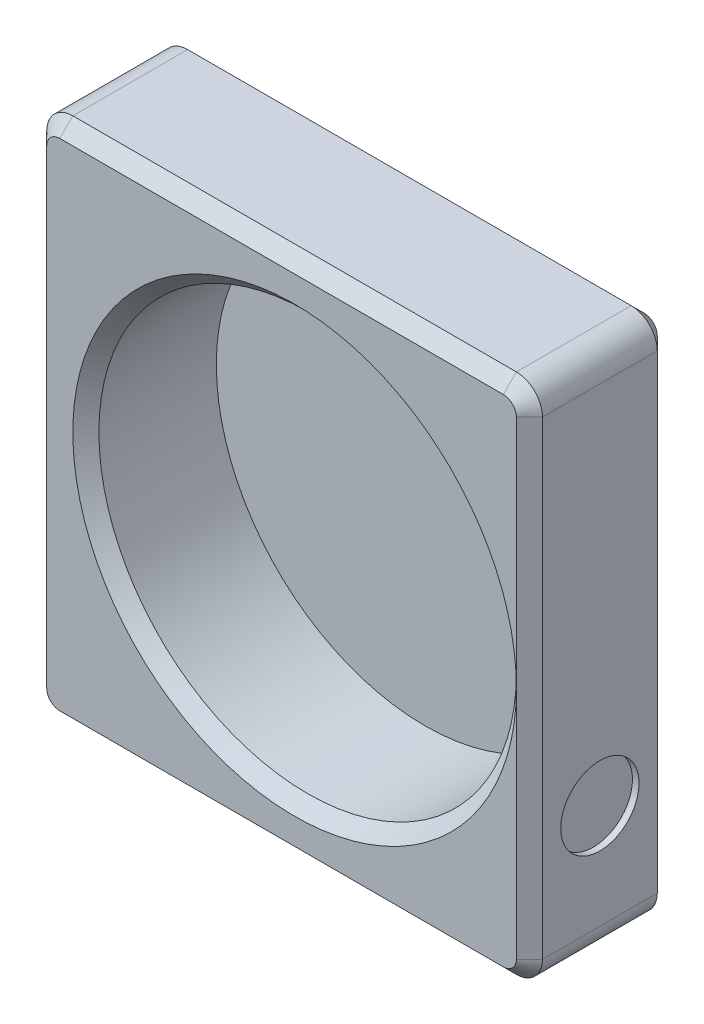
from build123d import *

# Parameters (mm, degrees)
SKETCH1_W           = 20
SKETCH1_H           = 20
BOSS_EXTRUDE1_DEPTH = 5.4
SKETCH2_R           = 8
CUT_EXTRUDE1_DEPTH  = 5
SKETCH4_W           = 1
SKETCH4_H           = 20
CUT_EXTRUDE3_DEPTH  = 10
SKETCH3_R           = 1.5
CUT_EXTRUDE2_DEPTH  = 0.25
SKETCH5_W           = 5.4
SKETCH5_H           = 1
CUT_EXTRUDE4_DEPTH  = 0.25
FILLET1_R           = 1
CHAMFER1_SIZE       = 0.5


with BuildPart() as part:
    # Sketch1 → Boss-Extrude1 (new body)
    with BuildSketch(Plane.XY):
        Rectangle(SKETCH1_W, SKETCH1_H)
    extrude(amount=BOSS_EXTRUDE1_DEPTH)

    # Sketch2 → Cut-Extrude1 (cut)
    with BuildSketch(Plane.XY.offset(5.4)):
        Circle(SKETCH2_R)
    extrude(amount=-CUT_EXTRUDE1_DEPTH, mode=Mode.SUBTRACT)

    # Sketch4 → Cut-Extrude3 (cut)
    with BuildSketch(Plane.XY.offset(5.4)):
        with Locations((9.5, 0)):
            Rectangle(SKETCH4_W, SKETCH4_H)
    extrude(amount=-CUT_EXTRUDE3_DEPTH, mode=Mode.SUBTRACT)

    # Sketch3 → Cut-Extrude2 (cut)
    with BuildSketch(Plane(origin=(9, 0, 0), x_dir=(0, 0, -1), z_dir=(1, 0, 0))):
        with Locations(Location((-2.7, -5, 0), (0, 0, 90))):
            Circle(SKETCH3_R)
    extrude(amount=-CUT_EXTRUDE2_DEPTH, mode=Mode.SUBTRACT)

    # Sketch5 → Cut-Extrude4 (cut)
    with BuildSketch(Plane.ZY.offset(10)):
        with Locations((2.7, 5)):
            Rectangle(SKETCH5_W, SKETCH5_H)
    extrude(amount=-CUT_EXTRUDE4_DEPTH, mode=Mode.SUBTRACT)

    # Fillet1
    fillet1_edges = [part.edges().sort_by_distance(p)[0] for p in [
        (9, -10, 2.7),
        (9, 10, 2.7),
        (-10, -10, 2.7),
        (-10, 10, 2.7),
    ]]
    fillet(fillet1_edges, radius=FILLET1_R)

    # Chamfer1
    # the kernel refuses this chamfer: 0.5 mm, written as the material it takes off along each edge
    with BuildSketch(Plane(origin=(8, 10, 0), x_dir=(0, -0.9996219169112968, -0.02749587661058639), z_dir=(-1, 0, 0)), Plane(origin=(-9, -10, 5.4), x_dir=(0, -0.027495876610585647, -0.9996219169112968), z_dir=(1, 0, 0))) as chamfer1_piece_1:
        Polygon((CHAMFER1_SIZE * 0.999621916911, CHAMFER1_SIZE * 0.0274958766106), (-CHAMFER1_SIZE * 0.0274958766106, CHAMFER1_SIZE * 0.999621916911), (0, 0), align=None)
    extrude(amount=17, mode=Mode.SUBTRACT)
    with BuildSketch(Plane(origin=(-9, 9, 0), x_dir=(0, 1, 0), z_dir=(1, 0, 0))) as chamfer1_piece_2:
        Polygon((1 - CHAMFER1_SIZE, 0), (1, CHAMFER1_SIZE), (1, 0), align=None)
    revolve(axis=Axis((-9, 9, 0), (0, 0, 1)), revolution_arc=90, mode=Mode.SUBTRACT)
    with BuildSketch(Plane(origin=(-10, 5.785841494, 0), x_dir=(0.9996219169112968, 0, -0.02749587661058639), z_dir=(0, -1, 0))) as chamfer1_piece_3:
        Polygon((CHAMFER1_SIZE * 0.999621916911, CHAMFER1_SIZE * 0.0274958766106), (-CHAMFER1_SIZE * 0.0274958766106, CHAMFER1_SIZE * 0.999621916911), (0, 0), align=None)
    extrude(amount=14.785841494, mode=Mode.SUBTRACT)
    with BuildSketch(Plane(origin=(-10, 9, 0), x_dir=(0.9996219169112968, 0, -0.02749587661058639), z_dir=(0, -1, 0))) as chamfer1_piece_4:
        Polygon((CHAMFER1_SIZE * 0.999621916911, CHAMFER1_SIZE * 0.0274958766106), (-CHAMFER1_SIZE * 0.0274958766106, CHAMFER1_SIZE * 0.999621916911), (0, 0), align=None)
    extrude(amount=4.785841494, mode=Mode.SUBTRACT)
    with BuildSketch(Plane(origin=(-9, -9, 0), x_dir=(0, -1, 0), z_dir=(1, 0, 0))) as chamfer1_piece_5:
        Polygon((1 - CHAMFER1_SIZE, 0), (1, -CHAMFER1_SIZE), (1, 0), align=None)
    revolve(axis=Axis((-9, -9, 0), (0, 0, -1)), revolution_arc=90, mode=Mode.SUBTRACT)
    with BuildSketch(Plane(origin=(-9, -10, 0), x_dir=(0, -0.02749587661058563, 0.9996219169112968), z_dir=(1, 0, 0)), Plane(origin=(8, 10, 5.4), x_dir=(0, -0.9996219169112968, 0.027495876610585647), z_dir=(-1, 0, 0))) as chamfer1_piece_6:
        Polygon((CHAMFER1_SIZE * 0.999621916911, -CHAMFER1_SIZE * 0.0274958766106), (-CHAMFER1_SIZE * 0.0274958766106, -CHAMFER1_SIZE * 0.999621916911), (0, 0), align=None)
    extrude(amount=17, mode=Mode.SUBTRACT)
    with BuildSketch(Plane(origin=(-9, -9, 5.4), x_dir=(0, -1, 0), z_dir=(1, 0, 0))) as chamfer1_piece_7:
        Polygon((1, CHAMFER1_SIZE), (1 - CHAMFER1_SIZE, 0), (1, 0), align=None)
    revolve(axis=Axis((-9, -9, 5.4), (0, 0, -1)), revolution_arc=90, mode=Mode.SUBTRACT)
    with BuildSketch(Plane(origin=(-10, 9, 5.4), x_dir=(0.9996219169112968, 0, 0.027495876610585647), z_dir=(0, -1, 0))) as chamfer1_piece_8:
        Polygon((CHAMFER1_SIZE * 0.999621916911, -CHAMFER1_SIZE * 0.0274958766106), (-CHAMFER1_SIZE * 0.0274958766106, -CHAMFER1_SIZE * 0.999621916911), (0, 0), align=None)
    extrude(amount=4.785841494, mode=Mode.SUBTRACT)
    with BuildSketch(Plane(origin=(-10, 5.785841494, 5.4), x_dir=(0.9996219169112968, 0, 0.027495876610585647), z_dir=(0, -1, 0))) as chamfer1_piece_9:
        Polygon((CHAMFER1_SIZE * 0.999621916911, -CHAMFER1_SIZE * 0.0274958766106), (-CHAMFER1_SIZE * 0.0274958766106, -CHAMFER1_SIZE * 0.999621916911), (0, 0), align=None)
    extrude(amount=14.785841494, mode=Mode.SUBTRACT)
    with BuildSketch(Plane(origin=(-9, 9, 5.4), x_dir=(0, 1, 0), z_dir=(1, 0, 0))) as chamfer1_piece_10:
        Polygon((1 - CHAMFER1_SIZE, 0), (1, -CHAMFER1_SIZE), (1, 0), align=None)
    revolve(axis=Axis((-9, 9, 5.4), (0, 0, 1)), revolution_arc=90, mode=Mode.SUBTRACT)
    with BuildSketch(Plane(origin=(0, 0, 5.4), x_dir=(1, 0, 0), z_dir=(0, -1, 0))) as chamfer1_piece_11:
        Polygon((8 + CHAMFER1_SIZE, 0), (8, -CHAMFER1_SIZE), (8, 0), align=None)
    revolve(axis=Axis((0, 0, 5.4), (0, 0, 1)), mode=Mode.SUBTRACT)
    with BuildSketch(Plane(origin=(9, 9, 0), x_dir=(-0.9996219169112968, 0, -0.02749587661058639), z_dir=(0, -1, 0))) as chamfer1_piece_12:
        Polygon((CHAMFER1_SIZE * 0.999621916911, -CHAMFER1_SIZE * 0.0274958766106), (-CHAMFER1_SIZE * 0.0274958766106, -CHAMFER1_SIZE * 0.999621916911), (0, 0), align=None)
    extrude(amount=18, mode=Mode.SUBTRACT)
    with BuildSketch(Plane(origin=(9, 9, 5.4), x_dir=(-0.9996219169112968, 0, 0.027495876610585647), z_dir=(0, -1, 0))) as chamfer1_piece_13:
        Polygon((CHAMFER1_SIZE * 0.999621916911, CHAMFER1_SIZE * 0.0274958766106), (-CHAMFER1_SIZE * 0.0274958766106, CHAMFER1_SIZE * 0.999621916911), (0, 0), align=None)
    extrude(amount=18, mode=Mode.SUBTRACT)
    with BuildSketch(Plane(origin=(8, 9, 0), x_dir=(1, 0, 0), z_dir=(0, -1, 0))) as chamfer1_piece_14:
        Polygon((1 - CHAMFER1_SIZE, 0), (1, CHAMFER1_SIZE), (1, 0), align=None)
    revolve(axis=Axis((8, 9, 0), (0, 0, 1)), revolution_arc=90, mode=Mode.SUBTRACT)
    with BuildSketch(Plane(origin=(8, -9, 0), x_dir=(0, -1, 0), z_dir=(-1, 0, 0))) as chamfer1_piece_15:
        Polygon((1 - CHAMFER1_SIZE, 0), (1, CHAMFER1_SIZE), (1, 0), align=None)
    revolve(axis=Axis((8, -9, 0), (0, 0, 1)), revolution_arc=90, mode=Mode.SUBTRACT)
    with BuildSketch(Plane(origin=(8, 9, 5.4), x_dir=(1, 0, 0), z_dir=(0, -1, 0))) as chamfer1_piece_16:
        Polygon((1 - CHAMFER1_SIZE, 0), (1, -CHAMFER1_SIZE), (1, 0), align=None)
    revolve(axis=Axis((8, 9, 5.4), (0, 0, 1)), revolution_arc=90, mode=Mode.SUBTRACT)
    with BuildSketch(Plane(origin=(8, -9, 5.4), x_dir=(0, -1, 0), z_dir=(-1, 0, 0))) as chamfer1_piece_17:
        Polygon((1, -CHAMFER1_SIZE), (1 - CHAMFER1_SIZE, 0), (1, 0), align=None)
    revolve(axis=Axis((8, -9, 5.4), (0, 0, 1)), revolution_arc=90, mode=Mode.SUBTRACT)


solid = part.part
